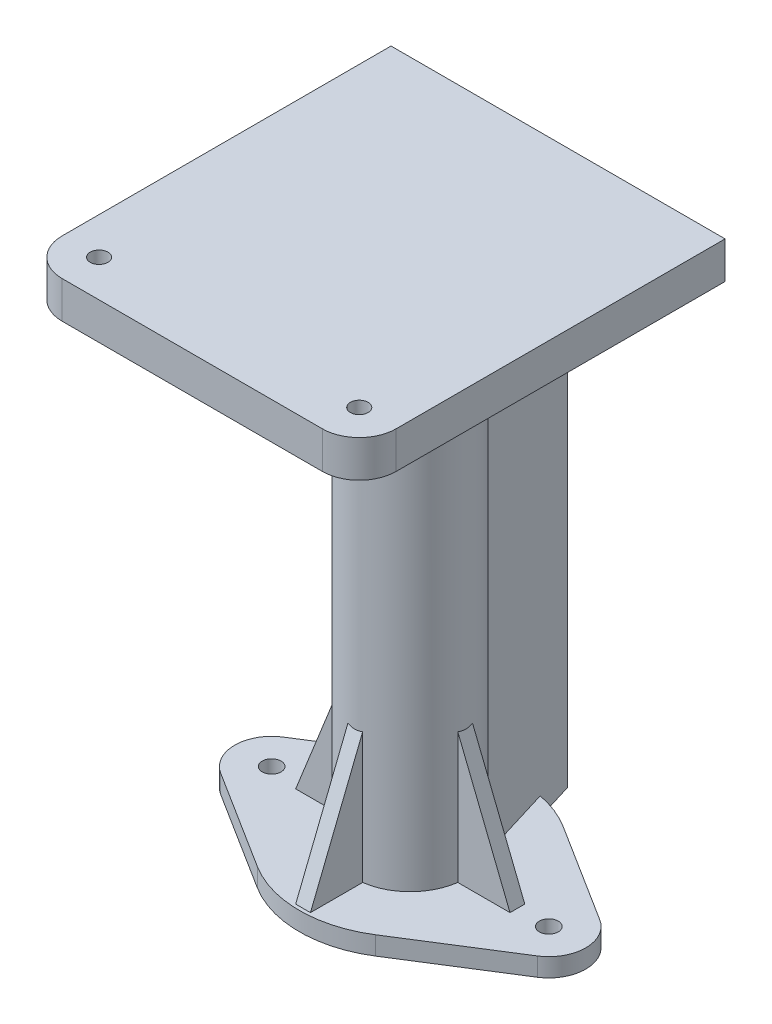
from build123d import *

# Parameters (mm, degrees)
SKETCH1_R                      = 2.55
SKETCH1_R_2                    = 11
BASE_DEPTH                     = 5
SKETCH1_3_R                    = 15
SKETCH1_3_R_2                  = 11
STEM_DEPTH                     = 150
RIBS_DEPTH                     = 2
CIRPATTERN1_COUNT              = 4
SKETCH4_W                      = 90.4
SKETCH4_H                      = 80
TOP_PLATE_DEPTH                = 10
SKETCH6_W                      = 90.4
SKETCH6_H                      = 10
BOSS_EXTRUDE7_DEPTH            = 19
RIB1_START                     = -2.5
RIB1_DEPTH                     = 5
CIRPATTERN6_COUNT              = 4
CUT_EXTRUDE1_REACH             = 170.039
SKETCH10_R                     = 2.4
CUT_EXTRUDE1_DIRECTION_2_DEPTH = 169.039429897
FILLET1_R                      = 10
FILLET2_R                      = 10
SKETCH13_W                     = 5
SKETCH13_H                     = 25.209800542
BOSS_EXTRUDE10_DEPTH           = 140
BOSS_EXTRUDE11_DEPTH           = 141
BOSS_EXTRUDE11_START           = -9.462383487
BOSS_EXTRUDE11_2_DEPTH         = 9.462383487
BOSS_EXTRUDE11_START_2         = -22
BOSS_EXTRUDE11_3_OUTLINE_W     = 26
BOSS_EXTRUDE11_3_OUTLINE_H     = 36
BOSS_EXTRUDE11_3_DEPTH         = 10.305131811
SKETCH16_W                     = 125.849741583
SKETCH16_H                     = 86.760976346
CUT_EXTRUDE2_DEPTH             = 169.039429897


with BuildPart() as part:
    # Sketch1 → base (new body)
    with BuildSketch(Plane(origin=(0, 0, 0), x_dir=(1, 0, 0), z_dir=(0, 1, 0))):
        with BuildLine():
            Line((-16, 25.377155081), (-42.833333333, 8.459051694))
            ThreePointArc((-42.833333333, 8.459051694), (-47.5, 0), (-42.833333333, -8.459051694))
            Line((-42.833333333, -8.459051694), (-16, -25.377155081))
            ThreePointArc((-16, -25.377155081), (0, -30), (16, -25.377155081))
            Line((16, -25.377155081), (42.833333333, -8.459051694))
            ThreePointArc((42.833333333, -8.459051694), (47.5, 0), (42.833333333, 8.459051694))
            Line((42.833333333, 8.459051694), (16, 25.377155081))
            ThreePointArc((16, 25.377155081), (0, 30), (-16, 25.377155081))
        make_face()
        with Locations(Location((-37.5, 0, 0), (0, 0, 270))):
            Circle(SKETCH1_R, mode=Mode.SUBTRACT)
        with Locations(Location((37.5, 0, 0), (0, 0, 270))):
            Circle(SKETCH1_R, mode=Mode.SUBTRACT)
        with Locations(Location((0, 0, 0), (0, 0, 270))):
            Circle(SKETCH1_R_2, mode=Mode.SUBTRACT)
    extrude(amount=BASE_DEPTH)

    # Sketch1<3> → stem (add)
    with BuildSketch(Plane(origin=(0, 0, 0), x_dir=(1, 0, 0), z_dir=(0, 1, 0))):
        with Locations(Location((0, 0, 0), (0, 0, 270))):
            Circle(SKETCH1_3_R)
        with Locations(Location((0, 0, 0), (0, 0, 270))):
            Circle(SKETCH1_3_R_2, mode=Mode.SUBTRACT)
    extrude(amount=STEM_DEPTH)

    # Sketch2 → ribs (add, symmetric)
    with BuildSketch(Plane(origin=(0, 0, 0), x_dir=(0, 0, -1), z_dir=(1, 0, 0))):
        Polygon((-13, 5), (-29, 5), (-13, 45), align=None)
    ribs = extrude(amount=RIBS_DEPTH, both=True)

    # CirPattern1: ribs ×4 about axis
    cirpattern1_axis = Axis((0, 0, 0), (0, 1, 0))
    for i in range(1, CIRPATTERN1_COUNT):
        add(ribs.rotate(cirpattern1_axis, i * 360 / CIRPATTERN1_COUNT))

    # Sketch4 → top plate (add)
    with BuildSketch(Plane(origin=(0, 150, 0), x_dir=(1, 0, 0), z_dir=(0, 1, 0))):
        Rectangle(SKETCH4_W, SKETCH4_H)
    extrude(amount=-TOP_PLATE_DEPTH)

    # Sketch6 → Boss-Extrude7 (add)
    with BuildSketch(Plane.XY.offset(40)):
        with Locations((0, 145)):
            Rectangle(SKETCH6_W, SKETCH6_H)
    extrude(amount=BOSS_EXTRUDE7_DEPTH)

    # Rib1: read off the stored shape, not the designer's step
    # Rib1 outline → Rib1 (add)
    with BuildSketch(Plane(origin=(0, 0, 0), x_dir=(0, 0, -1), z_dir=(1, 0, 0)).offset(RIB1_START)):
        Polygon((-15, 110), (-14.790199458, 110), (-14.790199458, 140), (-40, 140), align=None)
    rib1 = extrude(amount=RIB1_DEPTH)

    # CirPattern6: Rib1 ×4 about axis
    cirpattern6_axis = Axis((0, 0, 0), (0, 1, 0))
    for i in range(1, CIRPATTERN6_COUNT):
        add(rib1.rotate(cirpattern6_axis, i * 360 / CIRPATTERN6_COUNT))

    # Sketch10 → Cut-Extrude1 (cut, up to next)
    with BuildSketch(Plane(origin=(0, 150, 0), x_dir=(1, 0, 0), z_dir=(0, 1, 0)), mode=Mode.PRIVATE) as cut_extrude1_sk1:
        with Locations(Location((35.2, -49, 0), (0, 0, 90))):
            Circle(SKETCH10_R)
    cut_extrude1_tool1 = extrude(cut_extrude1_sk1.sketch, amount=-CUT_EXTRUDE1_REACH, mode=Mode.PRIVATE) & part.part
    # Sketch10 → Cut-Extrude1 (cut, up to next)
    with BuildSketch(Plane(origin=(0, 150, 0), x_dir=(1, 0, 0), z_dir=(0, 1, 0)), mode=Mode.PRIVATE) as cut_extrude1_sk2:
        with Locations(Location((-35.2, -49, 0), (0, 0, 90))):
            Circle(SKETCH10_R)
    cut_extrude1_tool2 = extrude(cut_extrude1_sk2.sketch, amount=-CUT_EXTRUDE1_REACH, mode=Mode.PRIVATE) & part.part
    add(cut_extrude1_tool1.solids().sort_by_distance((35.2, 150, 49))[0], mode=Mode.SUBTRACT)
    add(cut_extrude1_tool2.solids().sort_by_distance((-35.2, 150, 49))[0], mode=Mode.SUBTRACT)

    # Sketch10 → Cut-Extrude1 direction 2 (cut)
    with BuildSketch(Plane(origin=(0, 150, 0), x_dir=(1, 0, 0), z_dir=(0, 1, 0))):
        with Locations(Location((35.2, -49, 0), (0, 0, 90))):
            Circle(SKETCH10_R)
        with Locations(Location((-35.2, -49, 0), (0, 0, 90))):
            Circle(SKETCH10_R)
    extrude(amount=CUT_EXTRUDE1_DIRECTION_2_DEPTH, mode=Mode.SUBTRACT)

    # Fillet1
    fillet1_edges = [part.edges().sort_by_distance(p)[0] for p in [
        (-45.2, 145, 59),
    ]]
    fillet(fillet1_edges, radius=FILLET1_R)

    # Fillet2
    fillet2_edges = [part.edges().sort_by_distance(p)[0] for p in [
        (45.2, 145, 59),
    ]]
    fillet(fillet2_edges, radius=FILLET2_R)

    # Sketch13 → Boss-Extrude10 (add, through all)
    with BuildSketch(Plane.XZ.offset(-140)):
        with Locations((0, -27.395099729)):
            Rectangle(SKETCH13_W, SKETCH13_H)
    extrude(amount=BOSS_EXTRUDE10_DEPTH)

    # Boss-Extrude11: read off the stored shape, not the designer's step
    # Boss-Extrude11 outline → Boss-Extrude11 (add)
    with BuildSketch(Plane(origin=(0, 0, 0), x_dir=(1, 0, 0), z_dir=(0, 1, 0))):
        with BuildLine():
            ThreePointArc((2.5, 14.790199458), (7.779960403, 12.824672164), (11.962383487, 9.049938193))
            Line((11.962383487, 9.049938193), (2.5, 40))
            Line((2.5, 40), (2.5, 14.790199458))
        make_face()
        with BuildLine():
            ThreePointArc((-11.962383487, 9.049938193), (-7.779960403, 12.824672164), (-2.5, 14.790199458))
            Line((-2.5, 14.790199458), (-2.5, 40))
            Line((-2.5, 40), (-11.962383487, 9.049938193))
        make_face()
    extrude(amount=BOSS_EXTRUDE11_DEPTH)

    # Boss-Extrude11 2 outline → Boss-Extrude11 2 (add)
    with BuildSketch(Plane(origin=(0, 0, 0), x_dir=(1, 0, 0), z_dir=(0, 1, 0)).offset(BOSS_EXTRUDE11_START)):
        with BuildLine():
            Line((-2.5, 40), (-11.962383487, 9.049938193))
            ThreePointArc((-11.962383487, 9.049938193), (0, 15), (11.962383487, 9.049938193))
            Line((11.962383487, 9.049938193), (2.5, 40))
            Line((2.5, 40), (-2.5, 40))
        make_face()
    extrude(amount=BOSS_EXTRUDE11_2_DEPTH)

    # Boss-Extrude11 3 outline → Boss-Extrude11 3 (cut)
    with BuildSketch(Plane(origin=(0, 0, 0), x_dir=(1, 0, 0), z_dir=(0, 0.9563047559630354, 0.2923717047227371)).offset(BOSS_EXTRUDE11_START_2)):
        with Locations((0, 22)):
            Rectangle(BOSS_EXTRUDE11_3_OUTLINE_W, BOSS_EXTRUDE11_3_OUTLINE_H)
    extrude(amount=BOSS_EXTRUDE11_3_DEPTH, mode=Mode.SUBTRACT)

    # Sketch16 → Cut-Extrude2 (cut, through all)
    with BuildSketch(Plane.XY):
        with Locations((6.783470695, -43.380488173)):
            Rectangle(SKETCH16_W, SKETCH16_H)
    extrude(amount=-CUT_EXTRUDE2_DEPTH, mode=Mode.SUBTRACT)


solid = part.part
